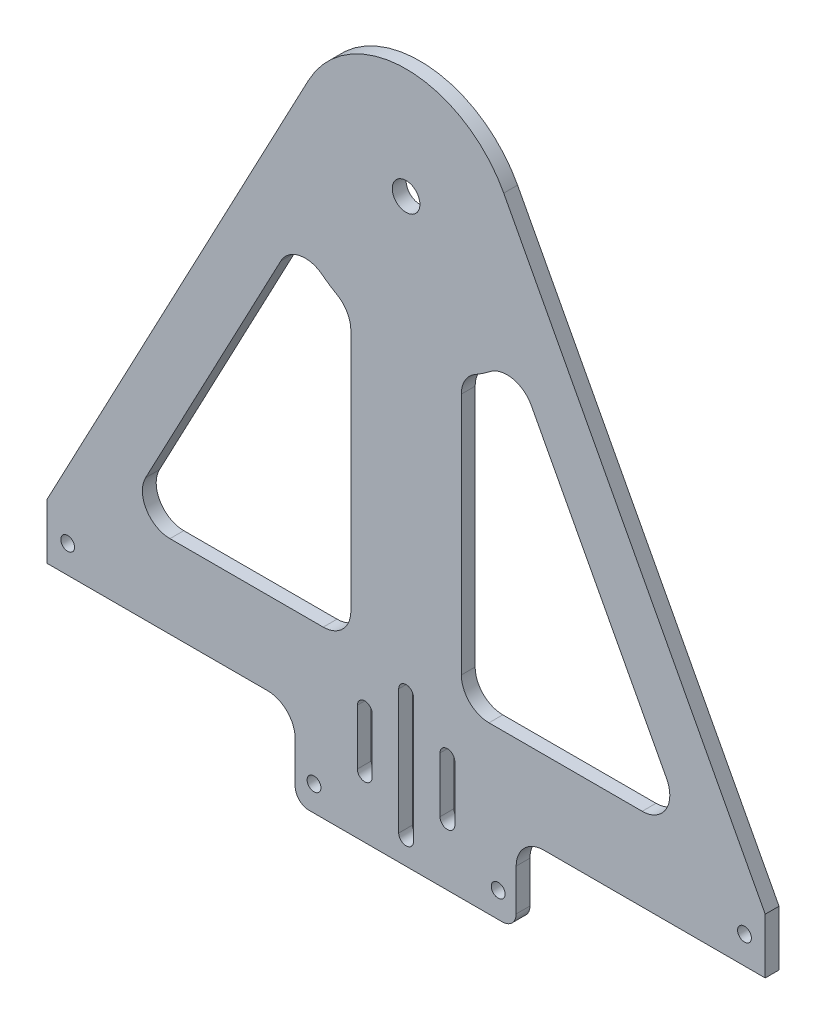
from build123d import *

# Parameters (mm, degrees)
SKETCH5_R           = 1.5875
SKETCH5_R_2         = 3.175
BOSS_EXTRUDE2_DEPTH = 3.175


with BuildPart() as part:
    # Sketch5 → Boss-Extrude2 (new body)
    with BuildSketch(Plane.XY):
        with BuildLine():
            Line((-82.55, 70.885609673), (-82.55, 58.185609673))
            Line((-82.55, 58.185609673), (-31.848963051, 58.185609673))
            ThreePointArc((-31.848963051, 58.185609673), (-27.35883499, 56.325737733), (-25.498963051, 51.835609673))
            Line((-25.498963051, 51.835609673), (-25.498963051, 42.310609673))
            ThreePointArc((-25.498963051, 42.310609673), (-24.569027081, 40.065545642), (-22.323963051, 39.135609673))
            Line((-22.323963051, 39.135609673), (22.126036949, 39.135609673))
            ThreePointArc((22.126036949, 39.135609673), (24.37110098, 40.065545642), (25.301036949, 42.310609673))
            Line((25.301036949, 42.310609673), (25.301036949, 51.835609673))
            ThreePointArc((25.301036949, 51.835609673), (27.160908889, 56.325737733), (31.651036949, 58.185609673))
            Line((31.651036949, 58.185609673), (82.55, 58.185609673))
            Line((82.55, 58.185609673), (82.55, 70.885609673))
            Line((82.55, 70.885609673), (22.446426721, 184.373331383))
            ThreePointArc((22.446426721, 184.373331383), (0, 197.885609673), (-22.446426721, 184.373331383))
            Line((-22.446426721, 184.373331383), (-82.55, 70.885609673))
        make_face()
        with Locations((-77.7875, 64.535609673)):
            Circle(SKETCH5_R, mode=Mode.SUBTRACT)
        with Locations((77.7875, 64.535609673)):
            Circle(SKETCH5_R, mode=Mode.SUBTRACT)
        with Locations((-21.166666667, 44.968966307)):
            Circle(SKETCH5_R, mode=Mode.SUBTRACT)
        with Locations((21.166666667, 44.968966307)):
            Circle(SKETCH5_R, mode=Mode.SUBTRACT)
        with Locations((0, 172.485609673)):
            Circle(SKETCH5_R_2, mode=Mode.SUBTRACT)
        with BuildLine():
            Line((-59.87897294, 86.5575401), (-28.80539088, 145.230757697))
            ThreePointArc((-28.80539088, 145.230757697), (-24.546211379, 148.463135508), (-19.3281535, 147.296624336))
            ThreePointArc((-19.3281535, 147.296624336), (-17.639343437, 146.086441824), (-15.875, 144.989303103))
            ThreePointArc((-15.875, 144.989303103), (-13.550738686, 142.665041789), (-12.7, 139.490041789))
            Line((-12.7, 139.490041789), (-12.7, 83.585609673))
            ThreePointArc((-12.7, 83.585609673), (-14.559871939, 79.095481612), (-19.05, 77.235609673))
            Line((-19.05, 77.235609673), (-54.26736626, 77.235609673))
            ThreePointArc((-54.26736626, 77.235609673), (-59.707690616, 80.310648468), (-59.87897294, 86.5575401))
        make_face(mode=Mode.SUBTRACT)
        with BuildLine():
            Line((59.87897294, 86.5575401), (28.80539088, 145.230757697))
            ThreePointArc((28.80539088, 145.230757697), (24.546211379, 148.463135508), (19.3281535, 147.296624336))
            ThreePointArc((19.3281535, 147.296624336), (17.639343437, 146.086441824), (15.875, 144.989303103))
            ThreePointArc((15.875, 144.989303103), (13.550738686, 142.665041789), (12.7, 139.490041789))
            Line((12.7, 139.490041789), (12.7, 83.585609673))
            ThreePointArc((12.7, 83.585609673), (14.559871939, 79.095481612), (19.05, 77.235609673))
            Line((19.05, 77.235609673), (54.26736626, 77.235609673))
            ThreePointArc((54.26736626, 77.235609673), (59.707690616, 80.310648468), (59.87897294, 86.5575401))
        make_face(mode=Mode.SUBTRACT)
        with BuildLine():
            Line((-11.2, 52.915063076), (-11.2, 65.615063076))
            ThreePointArc((-11.2, 65.615063076), (-9.5, 67.315063076), (-7.8, 65.615063076))
            Line((-7.8, 65.615063076), (-7.8, 52.915063076))
            ThreePointArc((-7.8, 52.915063076), (-9.5, 51.215063076), (-11.2, 52.915063076))
        make_face(mode=Mode.SUBTRACT)
        with BuildLine():
            Line((-1.7, 44.915063076), (-1.7, 73.615063076))
            ThreePointArc((-1.7, 73.615063076), (0, 75.315063076), (1.7, 73.615063076))
            Line((1.7, 73.615063076), (1.7, 44.915063076))
            ThreePointArc((1.7, 44.915063076), (0, 43.215063076), (-1.7, 44.915063076))
        make_face(mode=Mode.SUBTRACT)
        with BuildLine():
            Line((7.8, 52.915063076), (7.8, 65.615063076))
            ThreePointArc((7.8, 65.615063076), (9.5, 67.315063076), (11.2, 65.615063076))
            Line((11.2, 65.615063076), (11.2, 52.915063076))
            ThreePointArc((11.2, 52.915063076), (9.5, 51.215063076), (7.8, 52.915063076))
        make_face(mode=Mode.SUBTRACT)
    extrude(amount=BOSS_EXTRUDE2_DEPTH)


solid = part.part
